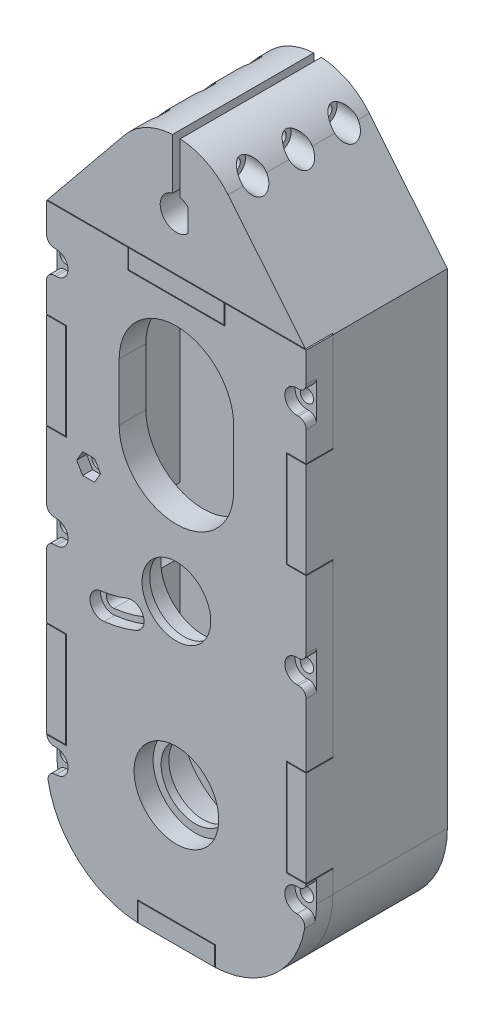
from build123d import *

# Parameters (mm, degrees)
SKETCH1_W                = 42
SKETCH1_H                = 42
BOSS_EXTRUDE1_DEPTH      = 7
SKETCH3_W                = 68
SKETCH3_H                = 152
SKETCH3_W_2              = 58
SKETCH3_H_2              = 142
BOSS_EXTRUDE2_DEPTH      = 30
CUT_EXTRUDE2_REACH       = 134.518
SKETCH4_R                = 9
SKETCH4_5_R              = 11.1
CUT_EXTRUDE3_DEPTH       = 5
CUT_EXTRUDE23_START      = 2
SKETCH4_7_R              = 11.1
SKETCH4_7_R_2            = 9
CUT_EXTRUDE23_DEPTH      = 131.517923316
SKETCH5_W                = 5
SKETCH5_H                = 25
SKETCH5_W_2              = 20
SKETCH5_H_2              = 5
SKETCH5_W_3              = 25
BOSS_EXTRUDE4_DEPTH      = 7
BOSS_EXTRUDE5_DEPTH      = 7
SKETCH8_R                = 9
CUT_EXTRUDE4_DEPTH       = 7
SKETCH8_3_R              = 11.1
SKETCH8_3_R_2            = 9
CUT_EXTRUDE5_DEPTH       = 5
CUT_EXTRUDE6_START       = -2
SKETCH8_4_R              = 11.1
SKETCH8_4_R_2            = 9
CUT_EXTRUDE6_DEPTH       = 5
SKETCH9_R                = 1.8
CUT_EXTRUDE7_DEPTH       = 7
CUT_EXTRUDE8_DEPTH       = 2.8
CUT_EXTRUDE9_DEPTH       = 2.6
CUT_EXTRUDE10_DEPTH      = 23
FILLET4_R                = 18
FILLET3_R                = 25
FILLET5_R                = 25
SKETCH14_R               = 1.75
CUT_EXTRUDE11_DEPTH      = 2.7
SKETCH14_2_R             = 1.75
CUT_EXTRUDE12_DEPTH      = 7
SKETCH15_R               = 1.5
CUT_EXTRUDE13_DEPTH      = 16
CUT_EXTRUDE14_DEPTH      = 7
FILLET6_R                = 2
BOSS_EXTRUDE12_DEPTH     = 29.9
BOSS_EXTRUDE13_DEPTH     = 7.1
BOSS_EXTRUDE14_START     = -37
BOSS_EXTRUDE14_DEPTH     = 37
CUT_EXTRUDE17_DEPTH      = 136.650285661
CUT_EXTRUDE17_DEPTH_BACK = 136.650285661
SKETCH23_R               = 1.75
CUT_EXTRUDE18_START      = 8
SKETCH23_3_R             = 3.1
SKETCH23_3_R_2           = 1.75
CUT_EXTRUDE18_DEPTH      = 128.650285689
CUT_EXTRUDE19_START      = -9
CUT_EXTRUDE19_DEPTH      = 127.650285689


with BuildPart() as part:
    # Sketch1 → Boss-Extrude1 (new body)
    # profile 1 of 2: a face of its own
    with BuildSketch(Plane.XY):
        Polygon((21, -21), (-21, -21), (-21, 21), (-29, 21), (-29, -121), (29, -121), (29, 21), (21, 21), align=None)
    # profile 2 of 2: a face of its own
    with BuildSketch(Plane.XY):
        Rectangle(SKETCH1_W, SKETCH1_H)
        with BuildLine():
            ThreePointArc((11.1, 3.5), (0, 14.6), (-11.1, 3.5))
            Line((-11.1, 3.5), (-11.1, -3.5))
            ThreePointArc((-11.1, -3.5), (0, -14.6), (11.1, -3.5))
            Line((11.1, -3.5), (11.1, 3.5))
        make_face(mode=Mode.SUBTRACT)
        with BuildLine():
            ThreePointArc((17.3, -12), (15.5, -10.2), (13.7, -12))
            Line((13.7, -12), (13.7, -19))
            ThreePointArc((13.7, -19), (15.5, -20.8), (17.3, -19))
            Line((17.3, -19), (17.3, -12))
        make_face(mode=Mode.SUBTRACT)
        with BuildLine():
            ThreePointArc((-13.7, -12), (-15.5, -10.2), (-17.3, -12))
            Line((-17.3, -12), (-17.3, -19))
            ThreePointArc((-17.3, -19), (-15.5, -20.8), (-13.7, -19))
            Line((-13.7, -19), (-13.7, -12))
        make_face(mode=Mode.SUBTRACT)
        with BuildLine():
            ThreePointArc((-13.7, 19), (-15.5, 20.8), (-17.3, 19))
            Line((-17.3, 19), (-17.3, 12))
            ThreePointArc((-17.3, 12), (-15.5, 10.2), (-13.7, 12))
            Line((-13.7, 12), (-13.7, 19))
        make_face(mode=Mode.SUBTRACT)
        with BuildLine():
            ThreePointArc((17.3, 19), (15.5, 20.8), (13.7, 19))
            Line((13.7, 19), (13.7, 12))
            ThreePointArc((13.7, 12), (15.5, 10.2), (17.3, 12))
            Line((17.3, 12), (17.3, 19))
        make_face(mode=Mode.SUBTRACT)
    extrude(amount=BOSS_EXTRUDE1_DEPTH)

    # Sketch3 → Boss-Extrude2 (add)
    with BuildSketch(Plane.XY):
        with Locations((0, -50)):
            Rectangle(SKETCH3_W, SKETCH3_H)
        with Locations((0, -50)):
            Rectangle(SKETCH3_W_2, SKETCH3_H_2, mode=Mode.SUBTRACT)
    extrude(amount=BOSS_EXTRUDE2_DEPTH)

    # Sketch4 → Cut-Extrude2 (cut, up to next)
    with BuildSketch(Plane(origin=(0, 0, 7), x_dir=(-1, 0, 0), z_dir=(0, 0, -1)), mode=Mode.PRIVATE) as cut_extrude2_sk1:
        with Locations(Location((0, -92, 0), (0, 0, 180))):
            Circle(SKETCH4_R)
    cut_extrude2_tool1 = extrude(cut_extrude2_sk1.sketch, amount=CUT_EXTRUDE2_REACH, mode=Mode.PRIVATE) & part.part
    # Sketch4 → Cut-Extrude2 (cut, up to next)
    with BuildSketch(Plane(origin=(0, 0, 7), x_dir=(-1, 0, 0), z_dir=(0, 0, -1)), mode=Mode.PRIVATE) as cut_extrude2_sk2:
        with Locations(Location((0, -48, 0), (0, 0, 180))):
            Circle(SKETCH4_R)
    cut_extrude2_tool2 = extrude(cut_extrude2_sk2.sketch, amount=CUT_EXTRUDE2_REACH, mode=Mode.PRIVATE) & part.part
    add(cut_extrude2_tool1.solids().sort_by_distance((0, -92, 7))[0], mode=Mode.SUBTRACT)
    add(cut_extrude2_tool2.solids().sort_by_distance((0, -48, 7))[0], mode=Mode.SUBTRACT)

    # Sketch4<5> → Cut-Extrude3 (cut)
    with BuildSketch(Plane(origin=(0, 0, 7), x_dir=(-1, 0, 0), z_dir=(0, 0, -1))):
        with Locations((0, -48)):
            Circle(SKETCH4_5_R)
    extrude(amount=CUT_EXTRUDE3_DEPTH, mode=Mode.SUBTRACT)

    # Sketch4<7> → Cut-Extrude23 (cut, through all)
    with BuildSketch(Plane(origin=(0, 0, 7), x_dir=(-1, 0, 0), z_dir=(0, 0, -1)).offset(CUT_EXTRUDE23_START)):
        with Locations(Location((0, -92, 0), (0, 0, 180))):
            Circle(SKETCH4_7_R)
        with Locations(Location((0, -92, 0), (0, 0, 180))):
            Circle(SKETCH4_7_R_2, mode=Mode.SUBTRACT)
    extrude(amount=CUT_EXTRUDE23_DEPTH, mode=Mode.SUBTRACT)

    # Sketch5 → Boss-Extrude4 (add)
    with BuildSketch(Plane.XY.offset(30)):
        with Locations((-31.5, -12.5)):
            Rectangle(SKETCH5_W, SKETCH5_H)
        with Locations((-31.5, -82.5)):
            Rectangle(SKETCH5_W, SKETCH5_H)
        with Locations((0, -123.5)):
            Rectangle(SKETCH5_W_2, SKETCH5_H_2)
        with Locations((31.5, -82.5)):
            Rectangle(SKETCH5_W, SKETCH5_H)
        with Locations((31.5, -12.5)):
            Rectangle(SKETCH5_W, SKETCH5_H)
        with Locations((0, 23.5)):
            Rectangle(SKETCH5_W_3, SKETCH5_H_2)
    extrude(amount=BOSS_EXTRUDE4_DEPTH)

    # Sketch12 → Cut-Extrude10 (cut)
    with BuildSketch(Plane.XY.offset(30)):
        with BuildLine():
            Line((-29, -50.5), (-29, -67.5))
            ThreePointArc((-29, -67.5), (-33.017879978, -59), (-29, -50.5))
        make_face()
    extrude(amount=-CUT_EXTRUDE10_DEPTH, mode=Mode.SUBTRACT)

    # Fillet4
    fillet4_edges = [part.edges().sort_by_distance(p)[0] for p in [
        (-29, -121, 18.5),
        (29, -121, 18.5),
    ]]
    fillet(fillet4_edges, radius=FILLET4_R)

    # Fillet3
    fillet3_edges = [part.edges().sort_by_distance(p)[0] for p in [
        (34, -126, 15),
        (-34, -126, 15),
    ]]
    fillet(fillet3_edges, radius=FILLET3_R)

    # Sketch15 → Cut-Extrude13 (cut)
    with BuildSketch(Plane.XY.offset(37)):
        with Locations((31.5, 13.1)):
            Circle(SKETCH15_R)
        with Locations((31.5, -48)):
            Circle(SKETCH15_R)
        with Locations((31.5, -100)):
            Circle(SKETCH15_R)
        with Locations((-31.5, -100)):
            Circle(SKETCH15_R)
        with Locations((-31.5, -48)):
            Circle(SKETCH15_R)
        with Locations((-31.5, 13.1)):
            Circle(SKETCH15_R)
    extrude(amount=-CUT_EXTRUDE13_DEPTH, mode=Mode.SUBTRACT)

    # Sketch20 → Boss-Extrude12 (add)
    with BuildSketch(Plane.XY):
        with BuildLine():
            ThreePointArc((-1, 57.47140521), (-7.955221873, 55.587316798), (-13.561630346, 51.060387984))
            ThreePointArc((-13.561630346, 51.060387984), (-17.370845552, 37.877801895), (-10.5, 26))
            Line((-10.5, 26), (10.5, 26))
            ThreePointArc((10.5, 26), (15.652475842, 32.173762079), (17.5, 40))
            ThreePointArc((17.5, 40), (16.486032437, 45.870326607), (13.561630346, 51.060387984))
            ThreePointArc((13.561630346, 51.060387984), (7.955221873, 55.587316798), (1, 57.47140521))
            Line((1, 57.47140521), (1, 44.13067791))
            ThreePointArc((1, 44.13067791), (3.340097304, 42.627974505), (4.25, 40))
            ThreePointArc((4.25, 40), (-2.627974505, 36.659902696), (-1, 44.13067791))
            Line((-1, 44.13067791), (-1, 57.47140521))
        make_face()
        with BuildLine():
            ThreePointArc((17.5, 40), (15.652475842, 32.173762079), (10.5, 26))
            Line((10.5, 26), (34, 26))
            Line((34, 26), (13.561630346, 51.060387984))
            ThreePointArc((13.561630346, 51.060387984), (16.486032437, 45.870326607), (17.5, 40))
        make_face()
        with BuildLine():
            Line((-13.561630346, 51.060387984), (-34, 26))
            Line((-34, 26), (-10.5, 26))
            ThreePointArc((-10.5, 26), (-17.370845552, 37.877801895), (-13.561630346, 51.060387984))
        make_face()
    extrude(amount=BOSS_EXTRUDE12_DEPTH)

    # Sketch21 → Boss-Extrude13 (add)
    with BuildSketch(Plane.XY.offset(29.9)):
        with BuildLine():
            Line((-33.836887045, 26.2), (33.836887045, 26.2))
            Line((33.836887045, 26.2), (13.561630346, 51.060387984))
            ThreePointArc((13.561630346, 51.060387984), (7.955221873, 55.587316798), (1, 57.47140521))
            Line((1, 57.47140521), (1, 44.13067791))
            ThreePointArc((1, 44.13067791), (0, 35.75), (-1, 44.13067791))
            Line((-1, 44.13067791), (-1, 57.47140521))
            ThreePointArc((-1, 57.47140521), (-7.955221873, 55.587316798), (-13.561630346, 51.060387984))
            Line((-13.561630346, 51.060387984), (-33.836887045, 26.2))
        make_face()
    extrude(amount=BOSS_EXTRUDE13_DEPTH)

    # Sketch22 → Boss-Extrude14 (add)
    with BuildSketch(Plane.XY.offset(37).offset(BOSS_EXTRUDE14_START)):
        with BuildLine():
            ThreePointArc((4.25, 40), (3.925079617, 41.629800601), (3, 43.010398645))
            Line((3, 43.010398645), (3, 36.989601355))
            ThreePointArc((3, 36.989601355), (3.925079617, 38.370199399), (4.25, 40))
        make_face()
    extrude(amount=BOSS_EXTRUDE14_DEPTH)

    # Sketch23 → Cut-Extrude17 (cut, two sides: drawn at the far end of the back side and taken through both)
    with BuildSketch(Plane(origin=(0, 0, 0), x_dir=(0, 0, -1), z_dir=(1, 0, 0)).offset(-CUT_EXTRUDE17_DEPTH_BACK)):
        with Locations(Location((-30, 51.47140521, 0), (0, 0, 346.4162178))):
            Circle(SKETCH23_R)
        with Locations(Location((-18, 51.47140521, 0), (0, 0, 346.4162178))):
            Circle(SKETCH23_R)
        with Locations(Location((-6, 51.47140521, 0), (0, 0, 346.4162178))):
            Circle(SKETCH23_R)
    extrude(amount=CUT_EXTRUDE17_DEPTH + CUT_EXTRUDE17_DEPTH_BACK, mode=Mode.SUBTRACT)

    # Sketch23<3> → Cut-Extrude18 (cut, through all)
    # profile 1 of 3: a face of its own
    with BuildSketch(Plane(origin=(0, 0, 0), x_dir=(0, 0, -1), z_dir=(1, 0, 0)).offset(CUT_EXTRUDE18_START)):
        with Locations(Location((-30, 51.47140521, 0), (0, 0, 187.619064708))):
            Circle(SKETCH23_3_R)
        with Locations((-30, 51.47140521)):
            Circle(SKETCH23_3_R_2, mode=Mode.SUBTRACT)
    # profile 2 of 3: a face of its own
    with BuildSketch(Plane(origin=(0, 0, 0), x_dir=(0, 0, -1), z_dir=(1, 0, 0)).offset(CUT_EXTRUDE18_START)):
        with Locations(Location((-6, 51.47140521, 0), (0, 0, 187.619064708))):
            Circle(SKETCH23_3_R)
        with Locations((-6, 51.47140521)):
            Circle(SKETCH23_3_R_2, mode=Mode.SUBTRACT)
    # profile 3 of 3: a face of its own
    with BuildSketch(Plane(origin=(0, 0, 0), x_dir=(0, 0, -1), z_dir=(1, 0, 0)).offset(CUT_EXTRUDE18_START)):
        with Locations(Location((-18, 51.47140521, 0), (0, 0, 187.619064708))):
            Circle(SKETCH23_3_R)
        with Locations((-18, 51.47140521)):
            Circle(SKETCH23_3_R_2, mode=Mode.SUBTRACT)
    extrude(amount=CUT_EXTRUDE18_DEPTH, mode=Mode.SUBTRACT)

    # Sketch24 → Cut-Extrude19 (cut, through all)
    with BuildSketch(Plane(origin=(0, 0, 0), x_dir=(0, 0, -1), z_dir=(1, 0, 0)).offset(CUT_EXTRUDE19_START)):
        Polygon((-28.383419246, 54.27140521), (-31.616580754, 54.27140521), (-33.233161507, 51.47140521), (-31.616580754, 48.67140521), (-28.383419246, 48.67140521), (-26.766838493, 51.47140521), align=None)
        Polygon((-16.383419246, 54.27140521), (-19.616580754, 54.27140521), (-21.233161507, 51.47140521), (-19.616580754, 48.67140521), (-16.383419246, 48.67140521), (-14.766838493, 51.47140521), align=None)
        Polygon((-4.383419246, 54.27140521), (-7.616580754, 54.27140521), (-9.233161507, 51.47140521), (-7.616580754, 48.67140521), (-4.383419246, 48.67140521), (-2.766838493, 51.47140521), align=None)
    extrude(amount=-CUT_EXTRUDE19_DEPTH, mode=Mode.SUBTRACT)


with BuildPart() as body_2:
    # Sketch7 → Boss-Extrude5 (new body)
    with BuildSketch(Plane.XY.offset(30)):
        Polygon((-34, -126), (-10.2, -126), (-10.2, -120.8), (10.2, -120.8), (10.2, -126), (34, -126), (34, -95.2), (28.8, -95.2), (28.8, -69.8), (34, -69.8), (34, -25.2), (28.8, -25.2), (28.8, 0.2), (34, 0.2), (34, 26), (12.7, 26), (12.7, 20.8), (-12.7, 20.8), (-12.7, 26), (-34, 26), (-34, 0.2), (-28.8, 0.2), (-28.8, -25.2), (-34, -25.2), (-34, -69.8), (-28.8, -69.8), (-28.8, -95.2), (-34, -95.2), align=None)
    extrude(amount=BOSS_EXTRUDE5_DEPTH)

    # Sketch8 → Cut-Extrude4 (cut)
    with BuildSketch(Plane.XY.offset(37)):
        with Locations((0, -92)):
            Circle(SKETCH8_R)
        with Locations((0, -48)):
            Circle(SKETCH8_R)
    extrude(amount=-CUT_EXTRUDE4_DEPTH, mode=Mode.SUBTRACT)

    # Sketch8<3> → Cut-Extrude5 (cut)
    with BuildSketch(Plane.XY.offset(37)):
        with Locations((0, -92)):
            Circle(SKETCH8_3_R)
        with Locations((0, -92)):
            Circle(SKETCH8_3_R_2, mode=Mode.SUBTRACT)
    extrude(amount=-CUT_EXTRUDE5_DEPTH, mode=Mode.SUBTRACT)

    # Sketch8<4> → Cut-Extrude6 (cut)
    with BuildSketch(Plane.XY.offset(37).offset(CUT_EXTRUDE6_START)):
        with Locations((0, -48)):
            Circle(SKETCH8_4_R)
        with Locations((0, -48)):
            Circle(SKETCH8_4_R_2, mode=Mode.SUBTRACT)
    extrude(amount=-CUT_EXTRUDE6_DEPTH, mode=Mode.SUBTRACT)

    # Sketch9 → Cut-Extrude7 (cut)
    with BuildSketch(Plane.XY.offset(37)):
        with BuildLine():
            ThreePointArc((-19.136943213, -60.564486251), (-15.05, -59.790217602), (-11.099083491, -58.489119794))
            ThreePointArc((-11.099083491, -58.489119794), (-10.103524814, -56.146287551), (-12.446357058, -55.150728874))
            ThreePointArc((-12.446357058, -55.150728874), (-15.95, -56.304532591), (-19.574270397, -56.991148184))
            ThreePointArc((-19.574270397, -56.991148184), (-21.142275838, -58.996480809), (-19.136943213, -60.564486251))
        make_face()
        with Locations((-23, -29)):
            Circle(SKETCH9_R)
    extrude(amount=-CUT_EXTRUDE7_DEPTH, mode=Mode.SUBTRACT)

    # Sketch10 → Cut-Extrude8 (cut)
    with BuildSketch(Plane.XY.offset(37)):
        with BuildLine():
            ThreePointArc((-18.954723554, -62.053377111), (-14.675, -61.242586357), (-10.537719505, -59.880116011))
            ThreePointArc((-10.537719505, -59.880116011), (-8.712528598, -55.584923564), (-13.007721044, -53.759732657))
            ThreePointArc((-13.007721044, -53.759732657), (-16.325, -54.852163836), (-19.756490056, -55.502257324))
            ThreePointArc((-19.756490056, -55.502257324), (-22.631166699, -59.178700469), (-18.954723554, -62.053377111))
        make_face()
    extrude(amount=-CUT_EXTRUDE8_DEPTH, mode=Mode.SUBTRACT)

    # Sketch11 → Cut-Extrude9 (cut)
    with BuildSketch(Plane.XY.offset(37)):
        Polygon((-21.441154273, -26.3), (-24.558845727, -26.3), (-26.117691454, -29), (-24.558845727, -31.7), (-21.441154273, -31.7), (-19.882308546, -29), align=None)
    extrude(amount=-CUT_EXTRUDE9_DEPTH, mode=Mode.SUBTRACT)

    # Fillet5
    # the kernel refuses this fillet: 25 mm, written as the material it takes off along each edge
    with BuildSketch(Plane(origin=(34, -126, -32.42795848), x_dir=(-1, 0, 0), z_dir=(0, 0, 1))) as fillet5_piece_1:
        with BuildLine():
            CenterArc((25, -24.971183392), FILLET5_R, 92.751254589, 87.248745411)
            Line((0, -24.971183392), (-0.5, -24.971183392))
            Line((-0.5, -24.971183392), (-0.5, 0))
            Line((-0.5, 0), (0, 0.5))
            ThreePointArc((0, 0.5), (11.9, 0.5), (23.776, 0.499423668))
            Line((23.776, 0.499423668), (23.8, 0))
        make_face()
    extrude(amount=131.85591696, mode=Mode.SUBTRACT)
    with BuildSketch(Plane(origin=(-34, -126, -32.42795848), x_dir=(0, 1, 0), z_dir=(0, 0, 1))) as fillet5_piece_2:
        with BuildLine():
            CenterArc((24.971183392, -25), FILLET5_R, 90, 87.248745411)
            Line((0, -23.8), (-0.499423668, -23.776))
            ThreePointArc((-0.499423668, -23.776), (-0.5, -11.9), (-0.5, 0))
            Line((-0.5, 0), (0, 0.5))
            Line((0, 0.5), (24.971183392, 0.5))
            Line((24.971183392, 0.5), (24.971183392, 0))
        make_face()
    extrude(amount=131.85591696, mode=Mode.SUBTRACT)

    # Sketch14 → Cut-Extrude11 (cut)
    # profile 1 of 6: a face of its own
    with BuildSketch(Plane.XY.offset(37)):
        with BuildLine():
            Line((31.5, -44.9), (36.5, -44.9))
            ThreePointArc((36.5, -44.9), (39.6, -48), (36.5, -51.1))
            Line((36.5, -51.1), (31.5, -51.1))
            ThreePointArc((31.5, -51.1), (28.4, -48), (31.5, -44.9))
        make_face()
        with Locations((31.5, -48)):
            Circle(SKETCH14_R, mode=Mode.SUBTRACT)
    # profile 2 of 6: a face of its own
    with BuildSketch(Plane.XY.offset(37)):
        with BuildLine():
            Line((31.5, -96.9), (36.5, -96.9))
            ThreePointArc((36.5, -96.9), (39.6, -100), (36.5, -103.1))
            Line((36.5, -103.1), (31.5, -103.1))
            ThreePointArc((31.5, -103.1), (28.4, -100), (31.5, -96.9))
        make_face()
        with Locations((31.5, -100)):
            Circle(SKETCH14_R, mode=Mode.SUBTRACT)
    # profile 3 of 6: a face of its own
    with BuildSketch(Plane.XY.offset(37)):
        with BuildLine():
            Line((-31.5, -44.9), (-36.5, -44.9))
            ThreePointArc((-36.5, -44.9), (-39.6, -48), (-36.5, -51.1))
            Line((-36.5, -51.1), (-31.5, -51.1))
            ThreePointArc((-31.5, -51.1), (-28.4, -48), (-31.5, -44.9))
        make_face()
        with Locations((-31.5, -48)):
            Circle(SKETCH14_R, mode=Mode.SUBTRACT)
    # profile 4 of 6: a face of its own
    with BuildSketch(Plane.XY.offset(37)):
        with BuildLine():
            Line((31.5, 16.2), (36.5, 16.2))
            ThreePointArc((36.5, 16.2), (39.6, 13.1), (36.5, 10))
            Line((36.5, 10), (31.5, 10))
            ThreePointArc((31.5, 10), (28.4, 13.1), (31.5, 16.2))
        make_face()
        with Locations((31.5, 13.1)):
            Circle(SKETCH14_R, mode=Mode.SUBTRACT)
    # profile 5 of 6: a face of its own
    with BuildSketch(Plane.XY.offset(37)):
        with BuildLine():
            Line((-31.5, -96.9), (-36.5, -96.9))
            ThreePointArc((-36.5, -96.9), (-39.6, -100), (-36.5, -103.1))
            Line((-36.5, -103.1), (-31.5, -103.1))
            ThreePointArc((-31.5, -103.1), (-28.4, -100), (-31.5, -96.9))
        make_face()
        with Locations((-31.5, -100)):
            Circle(SKETCH14_R, mode=Mode.SUBTRACT)
    # profile 6 of 6: a face of its own
    with BuildSketch(Plane.XY.offset(37)):
        with BuildLine():
            Line((-31.5, 16.2), (-36.5, 16.2))
            ThreePointArc((-36.5, 16.2), (-39.6, 13.1), (-36.5, 10))
            Line((-36.5, 10), (-31.5, 10))
            ThreePointArc((-31.5, 10), (-28.4, 13.1), (-31.5, 16.2))
        make_face()
        with Locations((-31.5, 13.1)):
            Circle(SKETCH14_R, mode=Mode.SUBTRACT)
    extrude(amount=-CUT_EXTRUDE11_DEPTH, mode=Mode.SUBTRACT)

    # Sketch14<2> → Cut-Extrude12 (cut)
    with BuildSketch(Plane.XY.offset(37)):
        with Locations((-31.5, -100)):
            Circle(SKETCH14_2_R)
        with Locations((-31.5, -48)):
            Circle(SKETCH14_2_R)
        with Locations((-31.5, 13.1)):
            Circle(SKETCH14_2_R)
        with Locations((31.5, 13.1)):
            Circle(SKETCH14_2_R)
        with Locations((31.5, -48)):
            Circle(SKETCH14_2_R)
        with Locations((31.5, -100)):
            Circle(SKETCH14_2_R)
    extrude(amount=-CUT_EXTRUDE12_DEPTH, mode=Mode.SUBTRACT)

    # Sketch16 → Cut-Extrude14 (cut)
    with BuildSketch(Plane.XY.offset(37)):
        with BuildLine():
            Line((15, -0.5), (15, -15.5))
            ThreePointArc((15, -15.5), (0, -30.5), (-15, -15.5))
            Line((-15, -15.5), (-15, -0.5))
            ThreePointArc((-15, -0.5), (0, 14.5), (15, -0.5))
        make_face()
    extrude(amount=-CUT_EXTRUDE14_DEPTH, mode=Mode.SUBTRACT)

    # Fillet6
    # the kernel refuses this fillet: 2 mm, written as the material it takes off along each edge
    with BuildSketch(Plane(origin=(-33.914056261, -103.1, 42.935466168), x_dir=(0.13007437702080746, -0.9915042392459292, 0), z_dir=(0, 0, -1))) as fillet6_piece_1:
        with BuildLine():
            CenterArc((2.279219009, -1.997744023), FILLET6_R, 87.278359309, 100.19553099)
            Line((0.29621053, -2.257892777), (0.256550361, -2.263095752))
            Line((0.256550361, -2.263095752), (-0.03966017, -0.005202975))
            Line((-0.03966017, -0.005202975), (-0.001899349, 0.03995488))
            ThreePointArc((-0.001899349, 0.03995488), (1.187093234, 0.068199711), (2.376085817, 0.03995488))
            Line((2.376085817, 0.03995488), (2.374186467, 0))
        make_face()
    extrude(amount=8.635466168, mode=Mode.SUBTRACT)
    with BuildSketch(Plane(origin=(33.914056261, -103.1, 42.935466168), x_dir=(-0.13007437702080746, -0.9915042392459292, 0), z_dir=(0, 0, -1))) as fillet6_piece_2:
        with BuildLine():
            CenterArc((2.279219009, 1.997744023), FILLET6_R, 172.526109701, 100.19553099)
            Line((0.29621053, 2.257892777), (0.256550361, 2.263095752))
            Line((0.256550361, 2.263095752), (-0.03966017, 0.005202975))
            Line((-0.03966017, 0.005202975), (-0.001899349, -0.03995488))
            ThreePointArc((-0.001899349, -0.03995488), (1.187093234, -0.068199711), (2.376085817, -0.03995488))
            Line((2.376085817, -0.03995488), (2.374186467, 0))
        make_face()
    extrude(amount=8.635466168, mode=Mode.SUBTRACT)
    with BuildSketch(Plane(origin=(-34, 10, 42), x_dir=(0, -1, 0), z_dir=(0, 0, -1)), Plane(origin=(-34, 16.2, 34.3), x_dir=(0, 1, 0), z_dir=(0, 0, 1)), Plane(origin=(-34, -51.1, 42), x_dir=(0, -1, 0), z_dir=(0, 0, -1)), Plane(origin=(-34, -44.9, 34.3), x_dir=(0, 1, 0), z_dir=(0, 0, 1))) as fillet6_piece_3:
        with BuildLine():
            CenterArc((FILLET6_R, -FILLET6_R), FILLET6_R, 90, 90)
            Line((0, -FILLET6_R), (-FILLET6_R * 0.02, -FILLET6_R))
            Line((-FILLET6_R * 0.02, -FILLET6_R), (-FILLET6_R * 0.02, FILLET6_R * 0.02))
            Line((-FILLET6_R * 0.02, FILLET6_R * 0.02), (FILLET6_R, FILLET6_R * 0.02))
            Line((FILLET6_R, FILLET6_R * 0.02), (FILLET6_R, 0))
        make_face()
    extrude(amount=7.7, mode=Mode.SUBTRACT)
    with BuildSketch(Plane(origin=(34, -96.9, 34.3), x_dir=(0, 1, 0), z_dir=(0, 0, 1))) as fillet6_piece_4:
        with BuildLine():
            CenterArc((2, 1.977371993), FILLET6_R, 180, 81.373073441)
            Line((0, 1.977371993), (-0.04, 1.977371993))
            Line((-0.04, 1.977371993), (-0.04, 0))
            Line((-0.04, 0), (0, -0.04))
            ThreePointArc((0, -0.04), (0.85, -0.04), (1.694, -0.03954744))
            Line((1.694, -0.03954744), (1.7, 0))
        make_face()
    extrude(amount=7.643429983, mode=Mode.SUBTRACT)
    with BuildSketch(Plane(origin=(-34, -96.9, 34.3), x_dir=(0, 1, 0), z_dir=(0, 0, 1))) as fillet6_piece_5:
        with BuildLine():
            CenterArc((2, -1.977371993), FILLET6_R, 98.626926559, 81.373073441)
            Line((0, -1.977371993), (-0.04, -1.977371993))
            Line((-0.04, -1.977371993), (-0.04, 0))
            Line((-0.04, 0), (0, 0.04))
            ThreePointArc((0, 0.04), (0.85, 0.04), (1.694, 0.03954744))
            Line((1.694, 0.03954744), (1.7, 0))
        make_face()
    extrude(amount=7.643429983, mode=Mode.SUBTRACT)
    with BuildSketch(Plane(origin=(34, 16.2, 34.3), x_dir=(0, 1, 0), z_dir=(0, 0, 1)), Plane(origin=(34, 10, 42), x_dir=(0, -1, 0), z_dir=(0, 0, -1)), Plane(origin=(34, -44.9, 34.3), x_dir=(0, 1, 0), z_dir=(0, 0, 1)), Plane(origin=(34, -51.1, 42), x_dir=(0, -1, 0), z_dir=(0, 0, -1))) as fillet6_piece_6:
        with BuildLine():
            CenterArc((FILLET6_R, FILLET6_R), FILLET6_R, 180, 90)
            Line((0, FILLET6_R), (-FILLET6_R * 0.02, FILLET6_R))
            Line((-FILLET6_R * 0.02, FILLET6_R), (-FILLET6_R * 0.02, -FILLET6_R * 0.02))
            Line((-FILLET6_R * 0.02, -FILLET6_R * 0.02), (FILLET6_R, -FILLET6_R * 0.02))
            Line((FILLET6_R, -FILLET6_R * 0.02), (FILLET6_R, 0))
        make_face()
    extrude(amount=7.7, mode=Mode.SUBTRACT)


solid = Compound([part.part, body_2.part])
